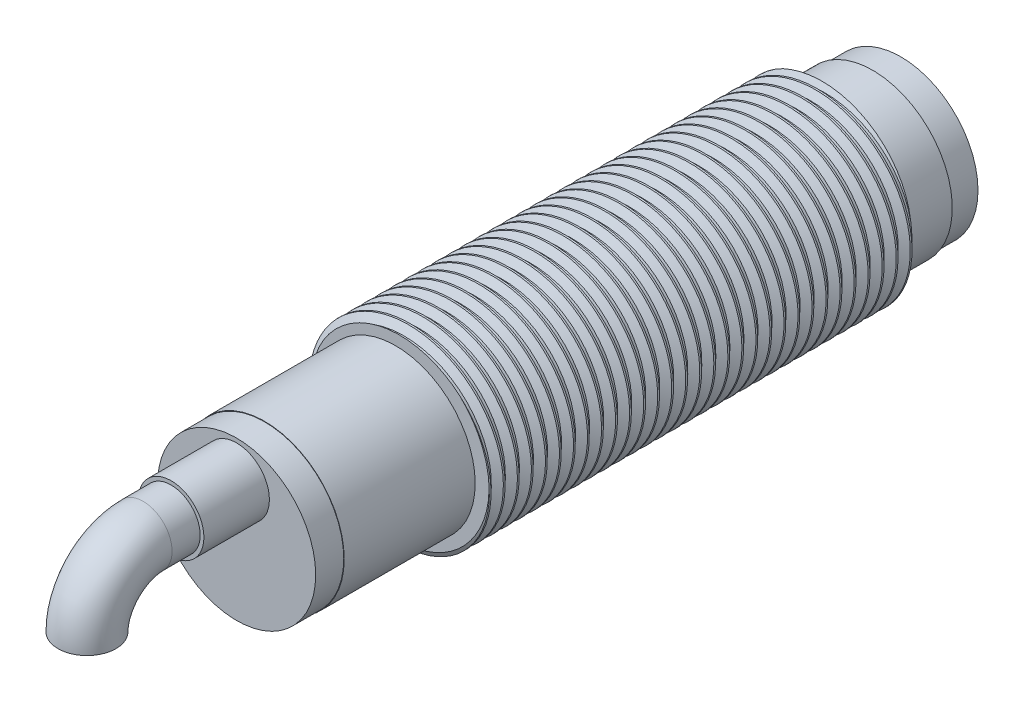
from build123d import *

# Parameters (mm, degrees)
SKETCH1_R           = 8.25
BOSS_EXTRUDE1_DEPTH = 3
SKETCH2_R           = 10
BOSS_EXTRUDE2_DEPTH = 65
SKETCH3_R           = 8.45
BOSS_EXTRUDE3_DEPTH = 3
THREAD1_PITCH       = 1.5
SKETCH13_R          = 12.910798792
SKETCH13_R_2        = 8.5
CUT_EXTRUDE1_DEPTH  = 5
CUT_EXTRUDE3_START  = -14
SKETCH20_R          = 11.050496868
SKETCH20_R_2        = 8.5
CUT_EXTRUDE3_DEPTH  = 14
SKETCH21_R          = 3.5
BOSS_EXTRUDE5_DEPTH = 7
SKETCH22_R          = 3.1


with BuildPart() as part:
    # Sketch1 → Boss-Extrude1 (new body)
    with BuildSketch(Plane.XY):
        Circle(SKETCH1_R)
    extrude(amount=BOSS_EXTRUDE1_DEPTH)

    # Sketch2 → Boss-Extrude2 (add)
    with BuildSketch(Plane.XY.offset(3)):
        Circle(SKETCH2_R)
    extrude(amount=BOSS_EXTRUDE2_DEPTH)

    # Sketch3 → Boss-Extrude3 (add)
    with BuildSketch(Plane.XY.offset(68)):
        Circle(SKETCH3_R)
    extrude(amount=BOSS_EXTRUDE3_DEPTH)

    # Thread1: the profile of Thread Profile1 profile screwed along a right-hand helix of 32 turns, 8 arcs to a turn; built about Z, then put on its axis
    thread1_z = Axis((0, 0, 0), (0, 0, 1))
    thread1_corners = [(10.0003, -3e-09, -0.000173205), (10.0003, -3e-09, 1.312673201), (9.188101188, -3e-09, 0.843749998), (9.188101188, -3e-09, 0.468749998)]
    with BuildLine(mode=Mode.PRIVATE) as thread1_profile:
        Line(thread1_corners[0], thread1_corners[1])
        Line(thread1_corners[1], thread1_corners[2])
        Line(thread1_corners[2], thread1_corners[3])
        Line(thread1_corners[3], thread1_corners[0])
    thread1_cap = Face(thread1_profile.wire())
    thread1_turn_angles = [0, 22.5, 45, 67.5, 90, 112.5, 135, 157.5, 180, 202.5, 225, 247.5, 270, 292.5, 315, 337.5, 360]
    thread1_turn_weights = [1, 0.9238795325112867, 1, 0.9238795325112867, 1, 0.9238795325112867, 1, 0.9238795325112867, 1, 0.9238795325112867, 1, 0.9238795325112867, 1, 0.9238795325112867, 1, 0.9238795325112867, 1]
    thread1_turn_rails = [Edge.make_bspline([Vector(p[0], p[1], 0).rotate(thread1_z, thread1_turn_angles[k]) / thread1_turn_weights[k] + Vector(0, 0, p[2] + THREAD1_PITCH * thread1_turn_angles[k] / 360) for k in range(17)], [0, 0, 0, 1, 1, 2, 2, 3, 3, 4, 4, 5, 5, 6, 6, 7, 7, 8, 8, 8], 2, thread1_turn_weights) for p in thread1_corners]
    thread1_turn_sides = [Face.make_surface_from_curves(thread1_turn_rails[p[0]], thread1_turn_rails[p[1]]) for p in [(0, 1), (1, 2), (2, 3), (3, 0)]]
    thread1 = Plane(origin=(0, 0, 6), x_dir=(0.999390827, 0.034899497, 0), z_dir=(0, 0, 1)) * Solid(Shell([*[p.moved(Location((0, 0, THREAD1_PITCH * i))) for i in range(32) for p in thread1_turn_sides], thread1_cap, thread1_cap.rotate(thread1_z, 11520).moved(Location((0, 0, THREAD1_PITCH * 11520 / 360)))]))
    add(thread1, mode=Mode.SUBTRACT)

    # Sketch13 → Cut-Extrude1 (cut)
    with BuildSketch(Plane(origin=(0, 0, 3), x_dir=(-1, 0, 0), z_dir=(0, 0, -1))):
        Circle(SKETCH13_R)
        Circle(SKETCH13_R_2, mode=Mode.SUBTRACT)
    extrude(amount=-CUT_EXTRUDE1_DEPTH, mode=Mode.SUBTRACT)

    # Sketch20 → Cut-Extrude3 (cut)
    with BuildSketch(Plane.XY.offset(68).offset(CUT_EXTRUDE3_START)):
        Circle(SKETCH20_R)
        with Locations(Location((0, 0, 0), (0, 0, 180))):
            Circle(SKETCH20_R_2, mode=Mode.SUBTRACT)
    extrude(amount=CUT_EXTRUDE3_DEPTH, mode=Mode.SUBTRACT)

    # Sketch21 → Boss-Extrude5 (add)
    with BuildSketch(Plane.XY.offset(71)):
        with Locations((0, 4.5)):
            Circle(SKETCH21_R)
    extrude(amount=BOSS_EXTRUDE5_DEPTH)

    # Sweep2: sweep along a path in Sketch23
    with BuildLine(Plane(origin=(0, 0, 0), x_dir=(0, 0, -1), z_dir=(1, 0, 0))) as sweep2_path:
        Line((-78, 4.5), (-81, 4.5))
        ThreePointArc((-81, 4.5), (-85.242640687, 2.742640687), (-87, -1.5))
    # Sketch22 → Sweep2 (sweep)
    with BuildSketch(Plane.XY.offset(78)):
        with Locations((0, 4.5)):
            Circle(SKETCH22_R)
    sweep(path=sweep2_path.line)


solid = part.part
